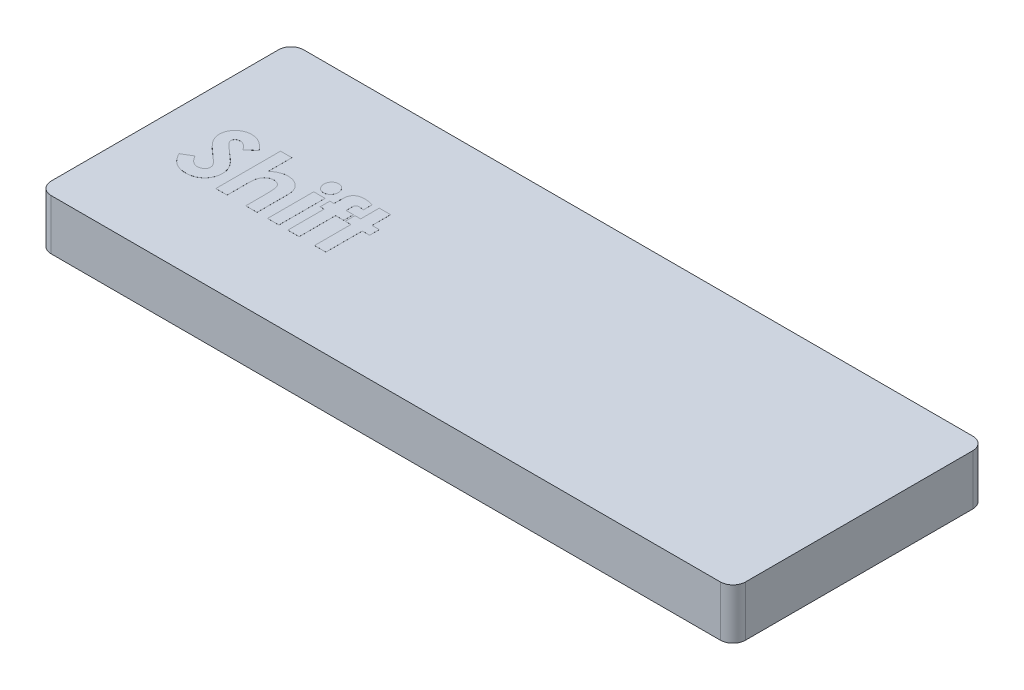
from build123d import *

# Parameters (mm, degrees)
SKETCH1_W           = 34.925
SKETCH1_H           = 12.7
BOSS_EXTRUDE1_DEPTH = 2.54
FILLET1_R           = 0.635
SHELL1_START        = 0.635
SHELL1_OUTLINE_W    = 1.905
SHELL1_OUTLINE_H    = 11.43
SHELL1_DEPTH        = 33.655
SKETCH2_R           = 2.54
BOSS_EXTRUDE2_DEPTH = 1.905
SKETCH3_W           = 0.569871795
SKETCH3_H           = 2.320192308
BOSS_EXTRUDE3_DEPTH = 0.00254


# Read off the part's stored shape, not the designer's step: Shell1
with BuildPart() as part:
    # Sketch1 → Boss-Extrude1 (new body)
    with BuildSketch(Plane(origin=(0, 0, 0), x_dir=(1, 0, 0), z_dir=(0, 1, 0))):
        with Locations((17.4625, 6.35)):
            Rectangle(SKETCH1_W, SKETCH1_H)
    extrude(amount=BOSS_EXTRUDE1_DEPTH)

    # Fillet1
    fillet1_edges = [part.edges().sort_by_distance(p)[0] for p in [
        (0, 1.27, -12.7),
        (34.925, 1.27, -12.7),
        (34.925, 1.27, 0),
        (0, 1.27, 0),
    ]]
    fillet(fillet1_edges, radius=FILLET1_R)

    # Shell1 outline → Shell1 (cut)
    with BuildSketch(Plane.YZ.offset(SHELL1_START)):
        with Locations((0.9525, -6.35)):
            Rectangle(SHELL1_OUTLINE_W, SHELL1_OUTLINE_H)
    extrude(amount=SHELL1_DEPTH, mode=Mode.SUBTRACT)

    # Sketch2 → Boss-Extrude2 (add)
    with BuildSketch(Plane(origin=(0, 1.905, 0), x_dir=(-1, 0, 0), z_dir=(0, -1, 0))):
        with Locations(Location((-17.4625, 6.35, 0), (0, 0, 270))):
            Circle(SKETCH2_R)
    extrude(amount=BOSS_EXTRUDE2_DEPTH)

    # Sketch3 → Boss-Extrude3 (add)
    with BuildSketch(Plane(origin=(0, 2.54, 0), x_dir=(1, 0, 0), z_dir=(0, 1, 0))):
        with BuildLine():
            Line((3.899551282, 7.195776242), (3.473419471, 6.805897436))
            add(Edge.make_bspline(
                [(3.473419471, 6.805897436), (3.455165812, 6.83164612), (3.420121331, 6.881080004), (3.363317883, 6.947273139), (3.306770931, 7.003740809), (3.249956603, 7.050247119), (3.192371318, 7.086509507), (3.134115036, 7.112183679), (3.075518028, 7.128504993), (3.036149883, 7.13053739), (3.016758814, 7.131538462)],
                knots=[0, 0, 0, 0, 1.299362458, 2.494594718, 3.587462134, 4.587049575, 5.512617175, 6.380583204, 7.202344345, 8, 8, 8, 8], degree=3))
            add(Edge.make_bspline(
                [(3.016758814, 7.131538462), (2.998671381, 7.130904137), (2.9637493, 7.129679422), (2.913965283, 7.117505847), (2.869766323, 7.096496044), (2.831195557, 7.06902396), (2.80064182, 7.035926467), (2.77624703, 7.001215707), (2.762510714, 6.962902879), (2.760702744, 6.936588082), (2.759807692, 6.923560697)],
                knots=[0, 0, 0, 0, 1.185010067, 2.2879431, 3.333075148, 4.379039566, 5.372662701, 6.27520591, 7.14612461, 8, 8, 8, 8], degree=3))
            add(Edge.make_bspline(
                [(2.759807692, 6.923560697), (2.760368576, 6.910345451), (2.761498118, 6.883731783), (2.772407957, 6.844726137), (2.788852199, 6.80661308), (2.804565344, 6.783411849), (2.812597155, 6.771552484)],
                knots=[0, 0, 0, 0, 0.967525499, 1.948461899, 2.951351359, 4, 4, 4, 4], degree=3))
            add(Edge.make_bspline(
                [(2.812597155, 6.771552484), (2.819898941, 6.762334324), (2.836706688, 6.741115336), (2.868755618, 6.707507766), (2.909002343, 6.666335552), (2.958995642, 6.619014485), (3.016660156, 6.563842714), (3.084668709, 6.502989063), (3.161063719, 6.434568965), (3.215363522, 6.386923686), (3.243817107, 6.361957131)],
                knots=[0, 0, 0, 0, 0.473873513, 1.090794244, 1.870441696, 2.795289791, 3.865433203, 5.087734844, 6.473946851, 8, 8, 8, 8], degree=3))
            add(Edge.make_bspline(
                [(3.243817107, 6.361957131), (3.27052489, 6.338842892), (3.321210714, 6.294976869), (3.393326575, 6.232716092), (3.456704406, 6.176701589), (3.512267478, 6.127774018), (3.559173508, 6.085420016), (3.597619689, 6.049437133), (3.628075577, 6.020525888), (3.645387966, 6.003063478), (3.652776442, 5.995610978)],
                knots=[0, 0, 0, 0, 1.543621617, 2.929473131, 4.163658386, 5.240097082, 6.164993805, 6.925417477, 7.541396219, 8, 8, 8, 8], degree=3))
            add(Edge.make_bspline(
                [(3.652776442, 5.995610978), (3.68080678, 5.965276149), (3.734690932, 5.906961956), (3.804721334, 5.816593297), (3.862358621, 5.728375058), (3.906947919, 5.640647272), (3.94062355, 5.5521442), (3.964365316, 5.46069531), (3.978584417, 5.365345018), (3.98016307, 5.300280084), (3.980961538, 5.267370793)],
                knots=[0, 0, 0, 0, 1.206664779, 2.319633467, 3.337109185, 4.282041471, 5.190008762, 6.099243693, 7.03861361, 8, 8, 8, 8], degree=3))
            add(Edge.make_bspline(
                [(3.980961538, 5.267370793), (3.980393209, 5.235304725), (3.979278125, 5.172389906), (3.965620483, 5.08032344), (3.946145488, 4.992211837), (3.91603373, 4.909013874), (3.879333696, 4.829363884), (3.833324904, 4.754502559), (3.779293886, 4.683672272), (3.717366044, 4.618139201), (3.648866497, 4.558672482), (3.575394222, 4.505733804), (3.496230772, 4.462026182), (3.412052505, 4.426036073), (3.322904481, 4.39831601), (3.228892901, 4.3778283), (3.12987397, 4.365531899), (3.062163397, 4.364246456), (3.027571114, 4.363589744)],
                knots=[0, 0, 0, 0, 1.043214005, 2.046824704, 3.02475056, 3.976699089, 4.921714032, 5.875962561, 6.831408892, 7.817874052, 8.806269674, 9.781291748, 10.760897367, 11.74438705, 12.757449933, 13.795994037, 14.874007457, 16, 16, 16, 16], degree=3))
            add(Edge.make_bspline(
                [(3.027571114, 4.363589744), (3.000416466, 4.364071485), (2.946634689, 4.36502561), (2.867368481, 4.372815242), (2.790827997, 4.385386881), (2.717099453, 4.403405794), (2.645850688, 4.426238201), (2.577078777, 4.454127112), (2.511258474, 4.487504794), (2.447891752, 4.525684869), (2.387286652, 4.570016965), (2.328676846, 4.619594728), (2.272644503, 4.675180684), (2.218920509, 4.736643377), (2.167848607, 4.804156853), (2.117757029, 4.876780861), (2.070871997, 4.955863206), (2.041909027, 5.011340111), (2.027115385, 5.039676482)],
                knots=[0, 0, 0, 0, 1.016823716, 2.013894106, 2.979844003, 3.91962641, 4.853723003, 5.779685073, 6.695824784, 7.614987388, 8.547259901, 9.504950863, 10.487499108, 11.500346958, 12.559593716, 13.656357062, 14.802919212, 16, 16, 16, 16], degree=3))
            Line((2.027115385, 5.039676482), (2.528297276, 5.340512821))
            add(Edge.make_bspline(
                [(2.528297276, 5.340512821), (2.546801911, 5.308347337), (2.582276879, 5.246683355), (2.642392527, 5.16382998), (2.703977941, 5.092879779), (2.768456918, 5.035086802), (2.835045419, 4.989678281), (2.904065082, 4.957226202), (2.975564398, 4.937138402), (3.024266484, 4.934685218), (3.048559696, 4.933461538)],
                knots=[0, 0, 0, 0, 1.283663364, 2.460892379, 3.537111102, 4.529833553, 5.449777664, 6.316464042, 7.160231139, 8, 8, 8, 8], degree=3))
            add(Edge.make_bspline(
                [(3.048559696, 4.933461538), (3.07326937, 4.934460861), (3.121209736, 4.936399693), (3.189638475, 4.954308096), (3.252376534, 4.982425604), (3.306606849, 5.022545409), (3.35252566, 5.068849762), (3.386416378, 5.120365473), (3.407706756, 5.176104227), (3.409957665, 5.214824033), (3.411089744, 5.234297877)],
                knots=[0, 0, 0, 0, 1.13588714, 2.203786484, 3.234766741, 4.283437687, 5.291419208, 6.222934724, 7.106237994, 8, 8, 8, 8], degree=3))
            add(Edge.make_bspline(
                [(3.411089744, 5.234297877), (3.410044316, 5.252415119), (3.407920629, 5.289218563), (3.392278206, 5.343939365), (3.367824328, 5.398635282), (3.338893665, 5.443498352), (3.309453094, 5.481060985), (3.281301267, 5.513607307), (3.247019789, 5.549565296), (3.206695583, 5.588980182), (3.160861436, 5.632198947), (3.109478739, 5.679217356), (3.051959106, 5.729621236), (3.011304117, 5.76395586), (2.990046074, 5.781909054)],
                knots=[0, 0, 0, 0, 0.916159276, 1.861089862, 2.860218735, 3.940849679, 4.552606315, 5.27541173, 6.11797699, 7.06649574, 8.129236253, 9.306560635, 10.591630461, 12, 12, 12, 12], degree=3))
            add(Edge.make_bspline(
                [(2.990046074, 5.781909054), (2.949633688, 5.816101808), (2.872070088, 5.881728051), (2.762462881, 5.978655946), (2.663696974, 6.069243946), (2.576625414, 6.154611915), (2.500138776, 6.233183306), (2.434755059, 6.305596305), (2.381192535, 6.37240948), (2.324829528, 6.451545214), (2.271273403, 6.547977544), (2.224985712, 6.663996816), (2.194956212, 6.780001367), (2.191591824, 6.857880433), (2.189935897, 6.896211939)],
                knots=[0, 0, 0, 0, 1.345494975, 2.582412109, 3.71882943, 4.751509156, 5.681369928, 6.505683931, 7.230279997, 7.856715994, 8.973648664, 10.023341002, 11.027102913, 12, 12, 12, 12], degree=3))
            add(Edge.make_bspline(
                [(2.189935897, 6.896211939), (2.190624595, 6.923394586), (2.191981404, 6.97694732), (2.204084347, 7.055688812), (2.222172657, 7.131667736), (2.248442076, 7.204606886), (2.28253661, 7.274414903), (2.323943098, 7.341433526), (2.373304502, 7.405045931), (2.428931473, 7.465209948), (2.490218153, 7.520193012), (2.555710758, 7.568721076), (2.625038596, 7.609708584), (2.697777553, 7.643710699), (2.774378363, 7.669737157), (2.85427671, 7.688186008), (2.937587195, 7.699158796), (2.994253188, 7.70065042), (3.02311899, 7.701410256)],
                knots=[0, 0, 0, 0, 1.010766082, 1.991317756, 2.957454644, 3.913069143, 4.869106762, 5.843196583, 6.838735724, 7.860187025, 8.887984031, 9.89767229, 10.887916223, 11.879572884, 12.879850636, 13.892031539, 14.926195476, 16, 16, 16, 16], degree=3))
            add(Edge.make_bspline(
                [(3.02311899, 7.701410256), (3.060527641, 7.700041768), (3.135049652, 7.697315594), (3.245232593, 7.675997805), (3.352854684, 7.642473336), (3.439578582, 7.602029753), (3.508583169, 7.562852034), (3.561468739, 7.526782126), (3.615282653, 7.485462108), (3.670458887, 7.438761769), (3.725972181, 7.385801214), (3.783401043, 7.32784121), (3.841962936, 7.264380848), (3.88001888, 7.219045059), (3.899551282, 7.195776242)],
                knots=[0, 0, 0, 0, 1.282922637, 2.555718331, 3.837320111, 5.142675274, 5.830281639, 6.55870424, 7.337177975, 8.157850921, 9.037902056, 9.96903443, 10.957596896, 12, 12, 12, 12], degree=3))
        make_face()
        with BuildLine():
            Line((4.469423077, 7.701410256), (5.039294872, 7.701410256))
            Line((5.039294872, 7.701410256), (5.039294872, 6.513965345))
            add(Edge.make_bspline(
                [(5.039294872, 6.513965345), (5.068000522, 6.537310475), (5.123952808, 6.582814179), (5.21174378, 6.642094709), (5.299353167, 6.692681392), (5.387710633, 6.733678441), (5.476432853, 6.765805428), (5.565673034, 6.78858935), (5.655517088, 6.803537614), (5.715747199, 6.80510999), (5.745910457, 6.805897436)],
                knots=[0, 0, 0, 0, 1.13710654, 2.216417683, 3.252896077, 4.244436563, 5.207303112, 6.149540546, 7.073289332, 8, 8, 8, 8], degree=3))
            add(Edge.make_bspline(
                [(5.745910457, 6.805897436), (5.77477467, 6.805131548), (5.831437545, 6.803628045), (5.914565418, 6.792768032), (5.99418532, 6.77408075), (6.07049339, 6.748391841), (6.142964644, 6.713844042), (6.212541489, 6.673375658), (6.278396912, 6.624890749), (6.318466186, 6.587516216), (6.338678886, 6.568662861)],
                knots=[0, 0, 0, 0, 1.056403236, 2.073808271, 3.062028718, 4.046096703, 5.014652014, 5.995532726, 6.988858718, 8, 8, 8, 8], degree=3))
            add(Edge.make_bspline(
                [(6.338678886, 6.568662861), (6.355278849, 6.551046127), (6.388719624, 6.515557058), (6.430369216, 6.454374724), (6.466333223, 6.38773198), (6.495638762, 6.315002589), (6.517433742, 6.236152696), (6.534307476, 6.151831879), (6.543639009, 6.061119449), (6.54479065, 5.998599316), (6.545384615, 5.966354167)],
                knots=[0, 0, 0, 0, 0.887296576, 1.787466942, 2.706642908, 3.663267187, 4.658426068, 5.705361056, 6.816525637, 8, 8, 8, 8], degree=3))
            Line((6.545384615, 5.966354167), (6.545384615, 4.445))
            Line((6.545384615, 4.445), (5.975512821, 4.445))
            Line((5.975512821, 4.445), (5.975512821, 5.453723958))
            add(Edge.make_bspline(
                [(5.975512821, 5.453723958), (5.975402093, 5.485737811), (5.97519015, 5.547015629), (5.973286893, 5.635012184), (5.970178815, 5.71495369), (5.965928376, 5.786864306), (5.959993836, 5.850443504), (5.954156798, 5.906146998), (5.945966066, 5.95370778), (5.933701483, 6.005387089), (5.913741958, 6.060662281), (5.884737521, 6.119583259), (5.845995562, 6.168211176), (5.801161325, 6.208317016), (5.749322467, 6.23892731), (5.692334769, 6.261535542), (5.629223994, 6.274249852), (5.585478445, 6.275882197), (5.56273738, 6.276730769)],
                knots=[0, 0, 0, 0, 1.461461505, 2.797388094, 4.017818807, 5.113567707, 6.085313608, 6.932873269, 7.669572396, 8.286941306, 9.355291607, 10.346554054, 11.270113241, 12.175128673, 13.078071705, 14.003657132, 14.962203834, 16, 16, 16, 16], degree=3))
            add(Edge.make_bspline(
                [(5.56273738, 6.276730769), (5.533112509, 6.275572635), (5.47508886, 6.2733043), (5.391880381, 6.249954498), (5.315131506, 6.213047173), (5.245737965, 6.161895281), (5.185268859, 6.097825498), (5.134605079, 6.022729315), (5.093164881, 5.937357856), (5.075253682, 5.875103511), (5.066007612, 5.842966747)],
                knots=[0, 0, 0, 0, 0.993549393, 1.945978497, 2.879753144, 3.843180486, 4.826017097, 5.826060929, 6.877775219, 8, 8, 8, 8], degree=3))
            add(Edge.make_bspline(
                [(5.066007612, 5.842966747), (5.063705321, 5.83303374), (5.058455344, 5.810383235), (5.054434813, 5.771737584), (5.048468407, 5.725021613), (5.046398757, 5.669955375), (5.042521812, 5.606623806), (5.04112751, 5.534924438), (5.039723802, 5.454789863), (5.039442445, 5.398603532), (5.039294872, 5.369133614)],
                knots=[0, 0, 0, 0, 0.514379255, 1.17295301, 1.959069106, 2.891908278, 3.953016936, 5.163065833, 6.51201855, 8, 8, 8, 8], degree=3))
            Line((5.039294872, 5.369133614), (5.039294872, 4.445))
            Line((5.039294872, 4.445), (4.469423077, 4.445))
            Line((4.469423077, 4.445), (4.469423077, 7.701410256))
        make_face()
        with BuildLine():
            add(Edge.make_bspline(
                [(7.358215144, 7.742115385), (7.382776615, 7.740910306), (7.431005428, 7.738544018), (7.500099766, 7.715477972), (7.563514366, 7.679276503), (7.61957463, 7.629607225), (7.666200316, 7.570293022), (7.701824072, 7.503886828), (7.721668582, 7.430310904), (7.724424691, 7.379485425), (7.725833333, 7.353508614)],
                knots=[0, 0, 0, 0, 0.989868614, 1.943702388, 2.910836514, 3.924849579, 4.949916355, 5.946401046, 6.950409252, 8, 8, 8, 8], degree=3))
            add(Edge.make_bspline(
                [(7.725833333, 7.353508614), (7.72447509, 7.327723237), (7.721828488, 7.277479203), (7.701367338, 7.204902107), (7.667173396, 7.138528166), (7.620170071, 7.080094889), (7.564717573, 7.031225564), (7.502688632, 6.994366879), (7.434256417, 6.972583993), (7.38677597, 6.970019896), (7.362667268, 6.968717949)],
                knots=[0, 0, 0, 0, 1.05296456, 2.051751585, 3.055639087, 4.085634717, 5.099016424, 6.062201612, 7.016062274, 8, 8, 8, 8], degree=3))
            add(Edge.make_bspline(
                [(7.362667268, 6.968717949), (7.337891396, 6.969918719), (7.289242994, 6.97227648), (7.21958194, 6.995396495), (7.155321552, 7.031312854), (7.099504476, 7.081996953), (7.052344822, 7.141732628), (7.018277126, 7.209684816), (6.996966939, 7.28376385), (6.994437439, 7.335342089), (6.993141026, 7.361776843)],
                knots=[0, 0, 0, 0, 0.989065327, 1.942068821, 2.907541208, 3.917690034, 4.939857478, 5.938239964, 6.943311734, 8, 8, 8, 8], degree=3))
            add(Edge.make_bspline(
                [(6.993141026, 7.361776843), (6.994551878, 7.387124368), (6.997323293, 7.436915923), (7.017286675, 7.508856038), (7.052093579, 7.57414584), (7.098383415, 7.632374241), (7.153951282, 7.681117001), (7.217327813, 7.716219008), (7.285957144, 7.73833236), (7.333880445, 7.740841356), (7.358215144, 7.742115385)],
                knots=[0, 0, 0, 0, 1.038616768, 2.040212704, 3.031499824, 4.052181184, 5.074969369, 6.039807101, 7.004644834, 8, 8, 8, 8], degree=3))
        make_face()
        with Locations((7.35948718, 5.605096154)):
            Rectangle(SKETCH3_W, SKETCH3_H)
        with BuildLine():
            Line((7.888653846, 6.765192308), (8.092179487, 6.765192308))
            add(Edge.make_bspline(
                [(8.092179487, 6.765192308), (8.092315498, 6.802082063), (8.092572677, 6.871835574), (8.094091531, 6.970625951), (8.095115769, 7.057556892), (8.096945283, 7.132615024), (8.09952013, 7.19558049), (8.102159621, 7.246449848), (8.104136776, 7.285544055), (8.106924302, 7.307512237), (8.108079928, 7.316619591)],
                knots=[0, 0, 0, 0, 1.604323161, 3.033556972, 4.296844687, 5.385167547, 6.298701784, 7.037230881, 7.60086462, 8, 8, 8, 8], degree=3))
            add(Edge.make_bspline(
                [(8.108079928, 7.316619591), (8.113498794, 7.347865774), (8.124061999, 7.408775157), (8.159029617, 7.493670503), (8.209840386, 7.567624069), (8.26370292, 7.619824405), (8.31361968, 7.655460253), (8.355495694, 7.678735301), (8.401028228, 7.698689131), (8.450364397, 7.714335325), (8.503034983, 7.727116265), (8.55960839, 7.736000941), (8.619774239, 7.740897177), (8.661194563, 7.741702843), (8.682403846, 7.742115385)],
                knots=[0, 0, 0, 0, 1.43722947, 2.801646624, 4.13175475, 5.486897933, 6.18427957, 6.91287343, 7.658885333, 8.438447905, 9.260561323, 10.118602268, 11.036630026, 12, 12, 12, 12], degree=3))
            add(Edge.make_bspline(
                [(8.682403846, 7.742115385), (8.714899955, 7.741101295), (8.782582814, 7.738989149), (8.886572021, 7.72191375), (8.996897314, 7.69577408), (9.071172975, 7.671449554), (9.109807692, 7.658797075)],
                knots=[0, 0, 0, 0, 0.891275659, 1.856347963, 2.884972697, 4, 4, 4, 4], degree=3))
            Line((9.109807692, 7.658797075), (9.109807692, 7.215492788))
            add(Edge.make_bspline(
                [(9.109807692, 7.215492788), (9.089085389, 7.221222156), (9.049563325, 7.23214934), (8.992697336, 7.244279486), (8.941459355, 7.251769821), (8.9092705, 7.253052989), (8.894197716, 7.253653846)],
                knots=[0, 0, 0, 0, 1.174725213, 2.24046353, 3.176077791, 4, 4, 4, 4], degree=3))
            add(Edge.make_bspline(
                [(8.894197716, 7.253653846), (8.877609057, 7.253304271), (8.846524467, 7.252649221), (8.803436702, 7.244315709), (8.766544388, 7.231194224), (8.747408813, 7.216208538), (8.738373397, 7.209132612)],
                knots=[0, 0, 0, 0, 1.199997209, 2.248609783, 3.173030359, 4, 4, 4, 4], degree=3))
            add(Edge.make_bspline(
                [(8.738373397, 7.209132612), (8.732905844, 7.202148276), (8.720826233, 7.186717594), (8.709846641, 7.155230286), (8.704272425, 7.115433108), (8.703293016, 7.085981135), (8.70275641, 7.069844752)],
                knots=[0, 0, 0, 0, 0.721105823, 1.593158367, 2.681320256, 4, 4, 4, 4], degree=3))
            Line((8.70275641, 7.069844752), (8.700848357, 6.765192308))
            Line((8.700848357, 6.765192308), (9.069102564, 6.765192308))
            Line((9.069102564, 6.765192308), (9.069102564, 6.276730769))
            Line((9.069102564, 6.276730769), (8.662051282, 6.276730769))
            Line((8.662051282, 6.276730769), (8.662051282, 4.445))
            Line((8.662051282, 4.445), (8.092179487, 4.445))
            Line((8.092179487, 4.445), (8.092179487, 6.276730769))
            Line((8.092179487, 6.276730769), (7.888653846, 6.276730769))
            Line((7.888653846, 6.276730769), (7.888653846, 6.765192308))
        make_face()
        Polygon((9.435448718, 7.701410256), (10.005320513, 7.701410256), (10.005320513, 6.765192308), (10.371666667, 6.765192308), (10.371666667, 6.276730769), (10.005320513, 6.276730769), (10.005320513, 4.445), (9.435448718, 4.445), (9.435448718, 6.276730769), (9.150512821, 6.276730769), (9.150512821, 6.765192308), (9.435448718, 6.765192308), align=None)
    extrude(amount=BOSS_EXTRUDE3_DEPTH)


solid = part.part
